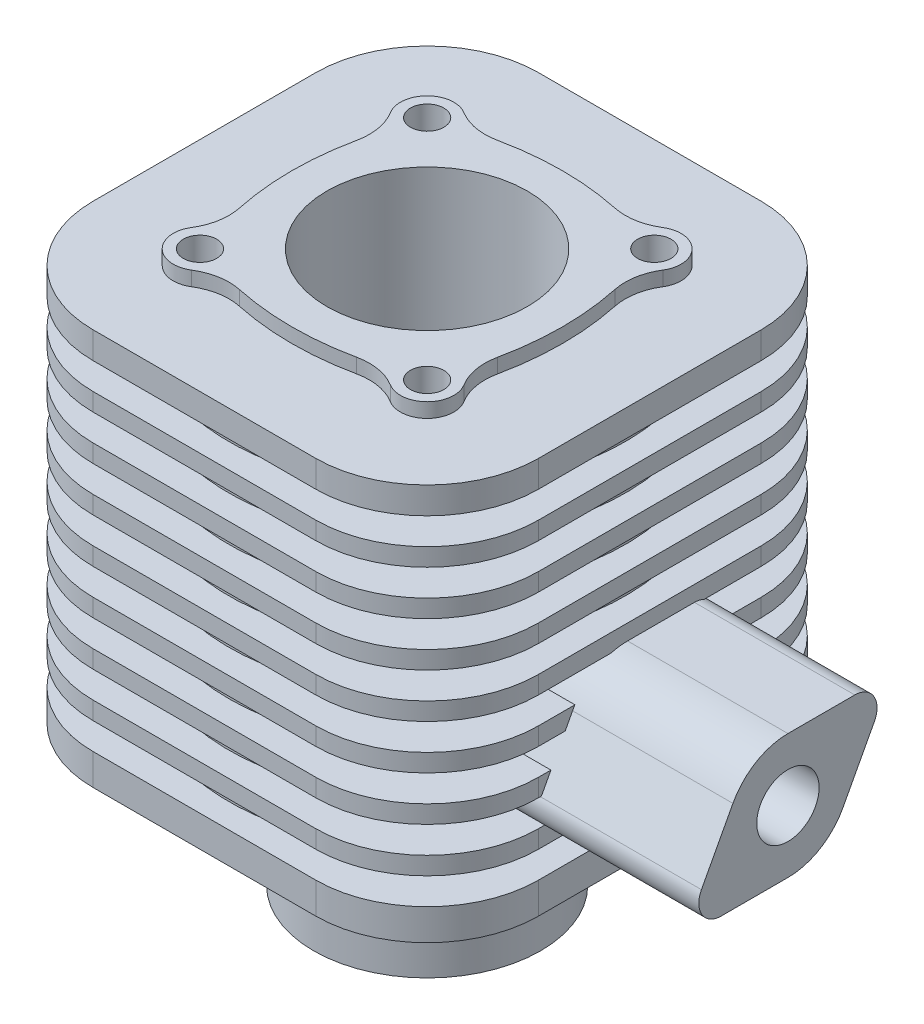
from build123d import *

# Parameters (mm, degrees)
BOSS_EXTRUDE1_DEPTH      = 114
BOSS_EXTRUDE1_DEPTH_BACK = 64
SKETCH2_R                = 45
CUT_EXTRUDE1_DEPTH       = 228.341153336
SKETCH3_R                = 51
SKETCH3_R_2              = 45
BOSS_EXTRUDE2_DEPTH      = 63
SKETCH4_W                = 39.255563261
SKETCH4_H                = 12
LPATTERN1_COUNT          = 8
LPATTERN1_PITCH          = 20
BOSS_EXTRUDE3_START      = 6.5
SKETCH5_R                = 45
BOSS_EXTRUDE3_DEPTH      = 6.5
HOLE1_START              = -64
HOLE1_OUTLINE_R          = 7.5
HOLE1_DEPTH              = 184.5
LPATTERN2_COUNT          = 2
LPATTERN2_PITCH          = 102
LPATTERN2_COUNT_DIR2     = 2
LPATTERN2_PITCH_DIR2     = 102
BOSS_EXTRUDE4_REACH      = 318.406
CUT_EXTRUDE2_REACH       = 318.406
CUT_EXTRUDE2_END_RADIUS  = 45
SKETCH7_3_R              = 14


# Read off the part's stored shape, not the designer's step: Hole1
with BuildPart() as part:
    # Sketch1 → Boss-Extrude1 (new, two sides: drawn at the far end of the back side and taken through both)
    with BuildSketch(Plane(origin=(0, 0, 0), x_dir=(1, 0, 0), z_dir=(0, 1, 0)).offset(-BOSS_EXTRUDE1_DEPTH_BACK)):
        with BuildLine():
            Line((-50, 100), (50, 100))
            ThreePointArc((50, 100), (85.355339059, 85.355339059), (100, 50))
            Line((100, 50), (100, -50))
            ThreePointArc((100, -50), (85.355339059, -85.355339059), (50, -100))
            Line((50, -100), (-50, -100))
            ThreePointArc((-50, -100), (-85.355339059, -85.355339059), (-100, -50))
            Line((-100, -50), (-100, 50))
            ThreePointArc((-100, 50), (-85.355339059, 85.355339059), (-50, 100))
        make_face()
    extrude(amount=BOSS_EXTRUDE1_DEPTH + BOSS_EXTRUDE1_DEPTH_BACK)

    # Sketch2 → Cut-Extrude1 (cut, through all)
    with BuildSketch(Plane(origin=(0, 114, 0), x_dir=(1, 0, 0), z_dir=(0, 1, 0))):
        with Locations(Location((0, 0, 0), (0, 0, 270))):
            Circle(SKETCH2_R)
    extrude(amount=-CUT_EXTRUDE1_DEPTH, mode=Mode.SUBTRACT)

    # Sketch3 → Boss-Extrude2 (add)
    with BuildSketch(Plane.XZ.offset(64)):
        with Locations(Location((0, 0, 0), (0, 0, 90))):
            Circle(SKETCH3_R)
        with Locations(Location((0, 0, 0), (0, 0, 90))):
            Circle(SKETCH3_R_2, mode=Mode.SUBTRACT)
    extrude(amount=BOSS_EXTRUDE2_DEPTH)

    # Sketch4 → Cut-Revolve1 (revolve, cut)
    with BuildSketch(Plane.XY, mode=Mode.PRIVATE) as cut_revolve1_sk:
        with Locations((108.627781631, 96)):
            Rectangle(SKETCH4_W, SKETCH4_H)
    cut_revolve1 = revolve(cut_revolve1_sk.sketch.rotate(Axis((0, 0, 0), (0, 1, 0)), 270), axis=Axis((0, 0, 0), (0, 1, 0)), mode=Mode.SUBTRACT)

    # LPattern1: Cut-Revolve1 ×8
    with Locations(*[(0, -i * LPATTERN1_PITCH, 0) for i in range(1, LPATTERN1_COUNT)]):
        add(cut_revolve1, mode=Mode.SUBTRACT)

    # Sketch5 → Boss-Extrude3 (add)
    with BuildSketch(Plane(origin=(0, 114, 0), x_dir=(1, 0, 0), z_dir=(0, 1, 0)).offset(BOSS_EXTRUDE3_START)):
        with BuildLine():
            ThreePointArc((-44.675675676, 61.198182281), (-59.485281374, 59.485281374), (-61.198182281, 44.675675676))
            ThreePointArc((-61.198182281, 44.675675676), (-57.818326802, 35.807754292), (-57.987125343, 26.319078947))
            ThreePointArc((-57.987125343, 26.319078947), (-60.744193619, 0), (-57.987125343, -26.319078947))
            ThreePointArc((-57.987125343, -26.319078947), (-57.818326802, -35.807754292), (-61.198182281, -44.675675676))
            ThreePointArc((-61.198182281, -44.675675676), (-59.485281374, -59.485281374), (-44.675675676, -61.198182281))
            ThreePointArc((-44.675675676, -61.198182281), (-35.807754292, -57.818326802), (-26.319078947, -57.987125343))
            ThreePointArc((-26.319078947, -57.987125343), (0, -60.744193619), (26.319078947, -57.987125343))
            ThreePointArc((26.319078947, -57.987125343), (35.807754292, -57.818326802), (44.675675676, -61.198182281))
            ThreePointArc((44.675675676, -61.198182281), (59.485281374, -59.485281374), (61.198182281, -44.675675676))
            ThreePointArc((61.198182281, -44.675675676), (57.818326802, -35.807754292), (57.987125343, -26.319078947))
            ThreePointArc((57.987125343, -26.319078947), (60.744193619, 0), (57.987125343, 26.319078947))
            ThreePointArc((57.987125343, 26.319078947), (57.818326802, 35.807754292), (61.198182281, 44.675675676))
            ThreePointArc((61.198182281, 44.675675676), (59.485281374, 59.485281374), (44.675675676, 61.198182281))
            ThreePointArc((44.675675676, 61.198182281), (35.807754292, 57.818326802), (26.319078947, 57.987125343))
            ThreePointArc((26.319078947, 57.987125343), (0, 60.744193619), (-26.319078947, 57.987125343))
            ThreePointArc((-26.319078947, 57.987125343), (-35.807754292, 57.818326802), (-44.675675676, 61.198182281))
        make_face()
        with Locations(Location((0, 0, 0), (0, 0, 270))):
            Circle(SKETCH5_R, mode=Mode.SUBTRACT)
    extrude(amount=-BOSS_EXTRUDE3_DEPTH)

    # Hole1 outline → Hole1 (cut)
    with BuildSketch(Plane(origin=(0, 0, 0), x_dir=(1, 0, 0), z_dir=(0, 1, 0)).offset(HOLE1_START)):
        with Locations((-51, -51)):
            Circle(HOLE1_OUTLINE_R)
    hole1 = extrude(amount=HOLE1_DEPTH, mode=Mode.SUBTRACT)

    # LPattern2: Hole1 2 × 2
    with Locations(*[(j * LPATTERN2_PITCH_DIR2, 0, -i * LPATTERN2_PITCH) for i in range(LPATTERN2_COUNT) for j in range(LPATTERN2_COUNT_DIR2) if (i, j) != (0, 0)]):
        add(hole1, mode=Mode.SUBTRACT)

    # Sketch7 → Boss-Extrude4 (add, up to next)
    with BuildSketch(Plane(origin=(172, 0, 0), x_dir=(0, 0, -1), z_dir=(1, 0, 0)), mode=Mode.PRIVATE) as boss_extrude4_sk1:
        with BuildLine():
            Line((-34.699424764, 8.188571429), (-48.83788517, -18.289795918))
            ThreePointArc((-48.83788517, -18.289795918), (-48.592851194, -28.142857143), (-40.01666204, -33))
            Line((-40.01666204, -33), (-10, -33))
            ThreePointArc((-10, -33), (4.4, -29.013329632), (14.699424764, -18.188571429))
            Line((14.699424764, -18.188571429), (28.83788517, 8.289795918))
            ThreePointArc((28.83788517, 8.289795918), (28.592851194, 18.142857143), (20.01666204, 23))
            Line((20.01666204, 23), (-10, 23))
            ThreePointArc((-10, 23), (-24.4, 19.013329632), (-34.699424764, 8.188571429))
        make_face()
    boss_extrude4_tool1 = extrude(boss_extrude4_sk1.sketch, amount=-BOSS_EXTRUDE4_REACH, mode=Mode.PRIVATE) - part.part
    add(boss_extrude4_tool1.solids().sort_by_distance((172, -5, 10))[0])

    # Cut-Extrude2: up to this cylinder (the profile starts outside it)
    cut_extrude2_end = Plane(origin=(0, -5, 0), z_dir=(0, 1, 0)) * Cylinder(CUT_EXTRUDE2_END_RADIUS, 727.812, mode=Mode.PRIVATE)
    # Sketch7<3> → Cut-Extrude2 (cut, up to the surface)
    with BuildSketch(Plane(origin=(172, 0, 0), x_dir=(0, 0, -1), z_dir=(1, 0, 0)), mode=Mode.PRIVATE) as cut_extrude2_sk1:
        with Locations((-10, -5)):
            Circle(SKETCH7_3_R)
    cut_extrude2_tool1 = extrude(cut_extrude2_sk1.sketch, amount=-CUT_EXTRUDE2_REACH, mode=Mode.PRIVATE) - cut_extrude2_end
    add(cut_extrude2_tool1.solids().sort_by_distance((172, -5, 10))[0], mode=Mode.SUBTRACT)


solid = part.part
